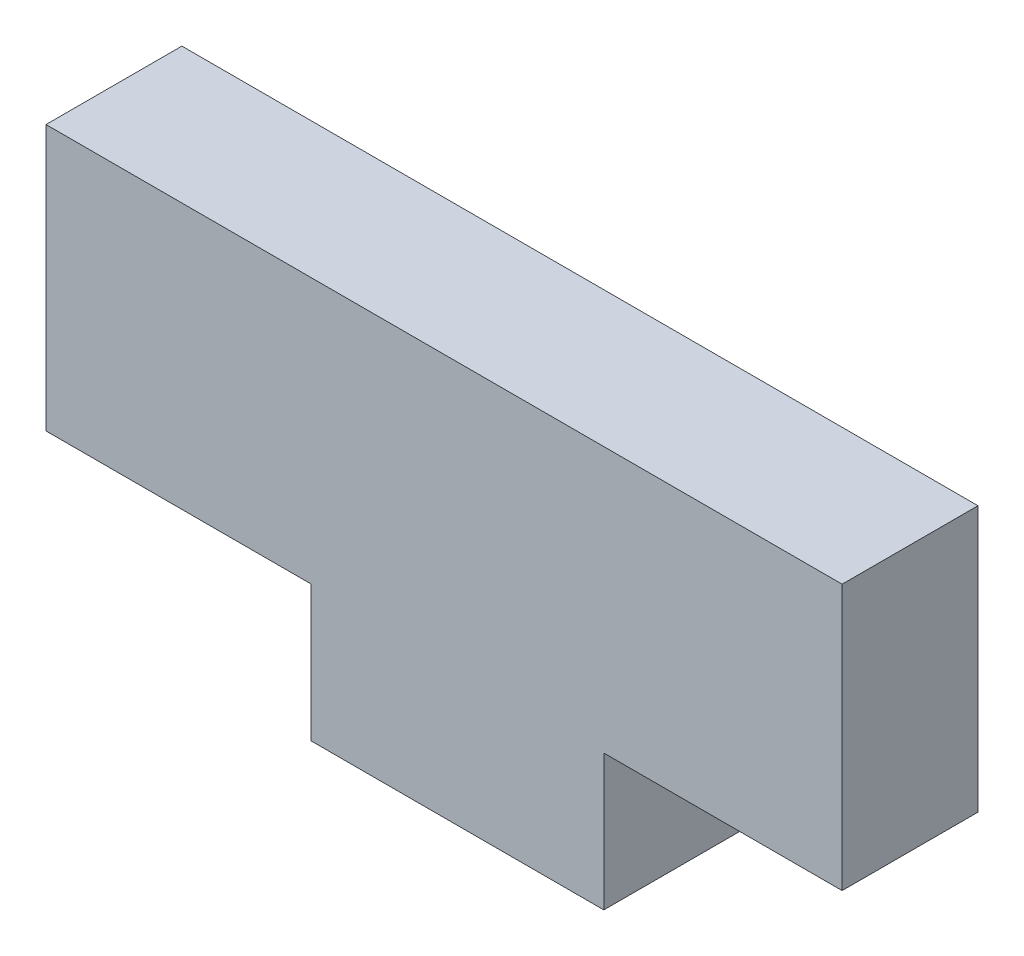
from build123d import *

# Parameters (mm, degrees)
BOSS_EXTRUDE1_DEPTH = 5.12


with BuildPart() as part:
    # Sketch1 → Boss-Extrude1 (new body)
    with BuildSketch(Plane.XY):
        Polygon((21.020160869, 0), (30, 0), (30, 10), (0, 10), (0, 0), (9.97731138, 0), (9.97731138, -5.12), (21.020160869, -5.12), align=None)
    extrude(amount=BOSS_EXTRUDE1_DEPTH)


solid = part.part
